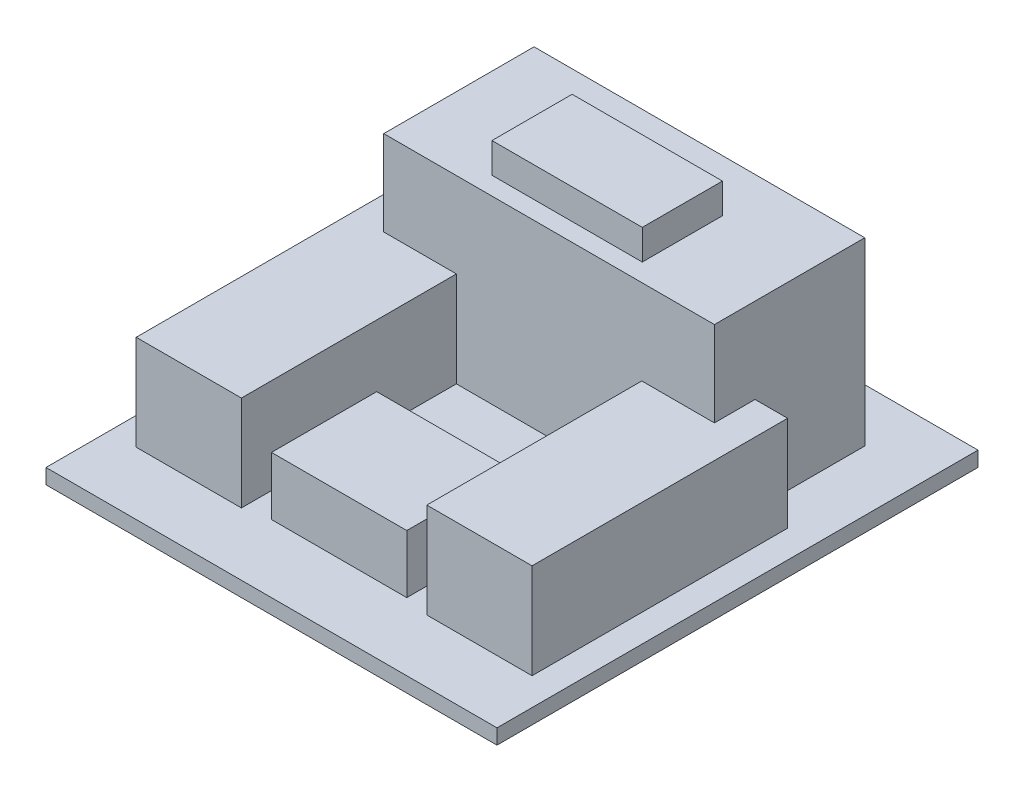
from build123d import *

# Parameters (mm, degrees)
SKETCH_1_W      = 450
SKETCH_1_H      = 480
EXTRUDE_1_DEPTH = 15
SKETCH_2_W      = 330
SKETCH_2_H      = 150
EXTRUDE_2_DEPTH = 180
SKETCH_3_W      = 105
SKETCH_3_H      = 255
EXTRUDE_3_DEPTH = 95
SKETCH_4_W      = 105
SKETCH_4_H      = 255
EXTRUDE_4_DEPTH = 95
SKETCH_5_W      = 135
SKETCH_5_H      = 105
EXTRUDE_5_DEPTH = 58
SKETCH_6_W      = 150
SKETCH_6_H      = 80
EXTRUDE_6_DEPTH = 210


with BuildPart() as part:
    # 草图1 → 凸台-拉伸1 (new body)
    with BuildSketch(Plane(origin=(0, 0, 0), x_dir=(1, 0, 0), z_dir=(0, 1, 0))):
        Rectangle(SKETCH_1_W, SKETCH_1_H)
    extrude(amount=-EXTRUDE_1_DEPTH)

    # 草图2 → 凸台-拉伸2 (add)
    with BuildSketch(Plane(origin=(0, 0, 0), x_dir=(1, 0, 0), z_dir=(0, 1, 0))):
        with Locations((0, 112)):
            Rectangle(SKETCH_2_W, SKETCH_2_H)
    extrude(amount=EXTRUDE_2_DEPTH)

    # 草图3 → 凸台-拉伸3 (add)
    with BuildSketch(Plane(origin=(0, 0, 0), x_dir=(1, 0, 0), z_dir=(0, 1, 0))):
        with Locations((-145, -50)):
            Rectangle(SKETCH_3_W, SKETCH_3_H)
    extrude(amount=EXTRUDE_3_DEPTH)

    # 草图4 → 凸台-拉伸4 (add)
    with BuildSketch(Plane(origin=(0, 0, 0), x_dir=(1, 0, 0), z_dir=(0, 1, 0))):
        with Locations((145, -50)):
            Rectangle(SKETCH_4_W, SKETCH_4_H)
    extrude(amount=EXTRUDE_4_DEPTH)

    # 草图5 → 凸台-拉伸5 (add)
    with BuildSketch(Plane(origin=(0, 0, 0), x_dir=(1, 0, 0), z_dir=(0, 1, 0))):
        with Locations((0, -120)):
            Rectangle(SKETCH_5_W, SKETCH_5_H)
    extrude(amount=EXTRUDE_5_DEPTH)

    # 草图6 → 凸台-拉伸6 (add)
    with BuildSketch(Plane(origin=(0, 0, 0), x_dir=(1, 0, 0), z_dir=(0, 1, 0))):
        with Locations((0, 95)):
            Rectangle(SKETCH_6_W, SKETCH_6_H)
    extrude(amount=EXTRUDE_6_DEPTH)


solid = part.part
